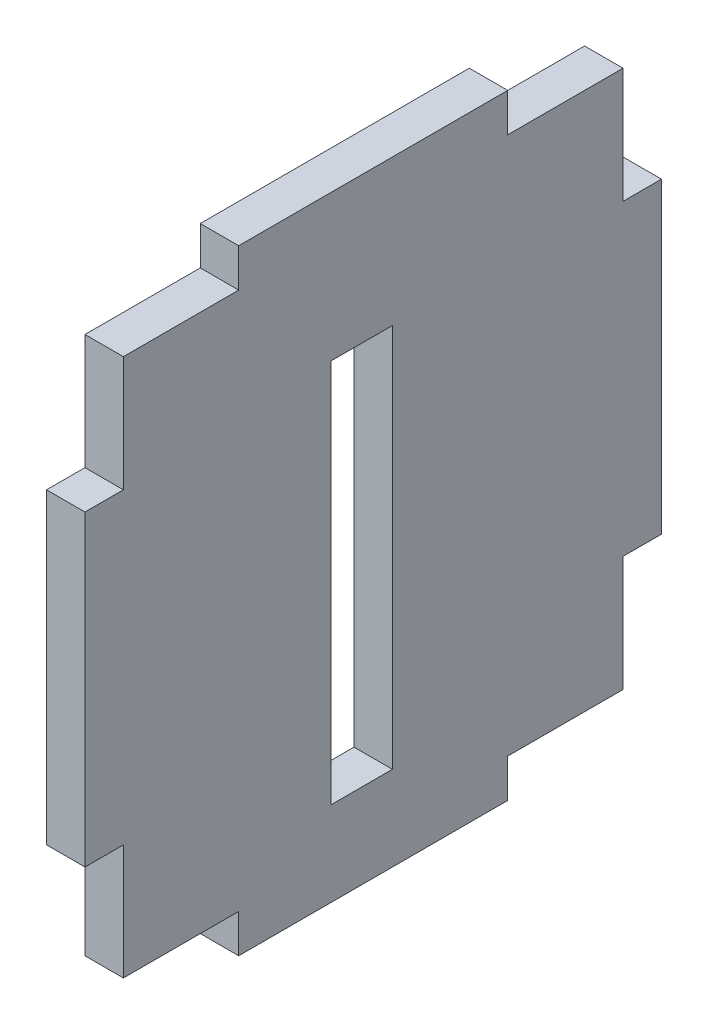
from build123d import *

# Parameters (mm, degrees)
SKETCH1_W                                = 75
SKETCH1_H                                = 80
BOSS_EXTRUDE1_DEPTH                      = 5
CUT_EXTRUDE1_DEPTH                       = 56.056788864
MIRROR1_AT_THE_SECOND_PLANE_COPY_1_DEPTH = 56.056788864
CUT_EXTRUDE2_DEPTH                       = 56.056788864
CUT_EXTRUDE2_DEPTH_BACK                  = 56.056788864
SKETCH4_W                                = 8
SKETCH4_H                                = 50


with BuildPart() as part:
    # Sketch1 → Boss-Extrude1 (new body)
    with BuildSketch(Plane(origin=(0, 0, 0), x_dir=(0, 0, -1), z_dir=(1, 0, 0))):
        Rectangle(SKETCH1_W, SKETCH1_H)
    extrude(amount=BOSS_EXTRUDE1_DEPTH)

    # Sketch3 → Cut-Extrude1 (cut, symmetric)
    with BuildSketch(Plane(origin=(5, 0, 0), x_dir=(0, 0, -1), z_dir=(1, 0, 0))):
        Polygon((-37.5, 20), (-32.5, 20), (-32.5, 35), (-17.5, 35), (-17.5, 40), (-37.5, 40), align=None)
    cut_extrude1 = extrude(amount=CUT_EXTRUDE1_DEPTH, both=True, mode=Mode.SUBTRACT)

    # Mirror1: Cut-Extrude1 across plane
    add(cut_extrude1.mirror(Plane.XY), mode=Mode.SUBTRACT)

    # Mirror1 at the second plane: Cut-Extrude1 across plane
    add(cut_extrude1.mirror(Plane.ZX), mode=Mode.SUBTRACT)

    # Mirror1 at the second plane copy 1 sketc → Mirror1 at the second plane copy 1 (cut, symmetric)
    with BuildSketch(Plane(origin=(5, 0, 0), x_dir=(0, 0, 1), z_dir=(1, 0, 0))):
        Polygon((-37.5, 20), (-32.5, 20), (-32.5, 35), (-17.5, 35), (-17.5, 40), (-37.5, 40), align=None)
    extrude(amount=MIRROR1_AT_THE_SECOND_PLANE_COPY_1_DEPTH, both=True, mode=Mode.SUBTRACT)

    # Sketch4 → Cut-Extrude2 (cut, two sides: drawn at the far end of the back side and taken through both)
    with BuildSketch(Plane(origin=(5, 0, 0), x_dir=(0, 0, -1), z_dir=(1, 0, 0)).offset(-CUT_EXTRUDE2_DEPTH_BACK)):
        with Locations((-1.5, -3.988080063)):
            Rectangle(SKETCH4_W, SKETCH4_H)
    extrude(amount=CUT_EXTRUDE2_DEPTH + CUT_EXTRUDE2_DEPTH_BACK, mode=Mode.SUBTRACT)


solid = part.part
